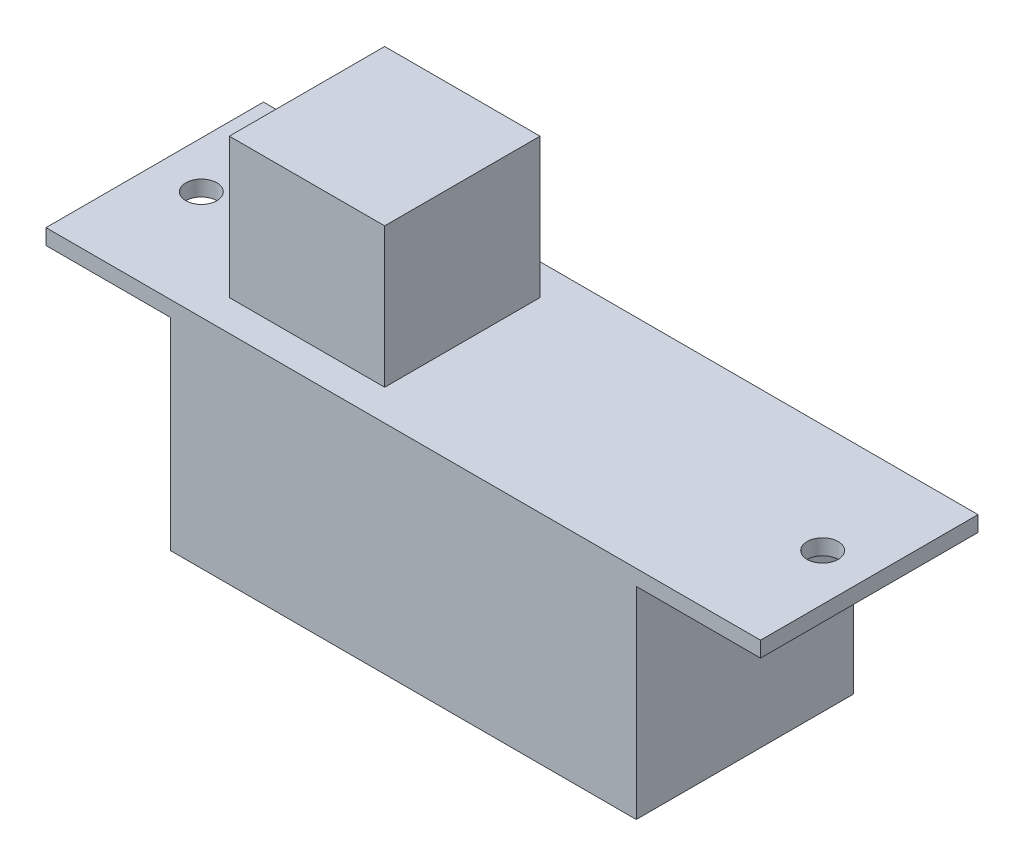
from build123d import *

# Parameters (mm, degrees)
SKETCH1_W           = 15
SKETCH1_H           = 7
BOSS_EXTRUDE1_DEPTH = 7
SKETCH2_W           = 23
SKETCH2_H           = 7
SKETCH2_R           = 0.5
BOSS_EXTRUDE2_DEPTH = 0.5
SKETCH3_W           = 5
SKETCH3_H           = 5
BOSS_EXTRUDE3_DEPTH = 4.5


with BuildPart() as part:
    # Sketch1 → Boss-Extrude1 (new body)
    with BuildSketch(Plane(origin=(0, 0, 0), x_dir=(1, 0, 0), z_dir=(0, 1, 0))):
        Rectangle(SKETCH1_W, SKETCH1_H)
    extrude(amount=BOSS_EXTRUDE1_DEPTH)

    # Sketch2 → Boss-Extrude2 (add)
    with BuildSketch(Plane(origin=(0, 7, 0), x_dir=(1, 0, 0), z_dir=(0, 1, 0))):
        Rectangle(SKETCH2_W, SKETCH2_H)
        with Locations((-10, 0)):
            Circle(SKETCH2_R, mode=Mode.SUBTRACT)
        with Locations((10, 0)):
            Circle(SKETCH2_R, mode=Mode.SUBTRACT)
    extrude(amount=-BOSS_EXTRUDE2_DEPTH)

    # Sketch3 → Boss-Extrude3 (add)
    with BuildSketch(Plane(origin=(0, 7, 0), x_dir=(1, 0, 0), z_dir=(0, 1, 0))):
        with Locations((-4.098942524, 0)):
            Rectangle(SKETCH3_W, SKETCH3_H)
    extrude(amount=BOSS_EXTRUDE3_DEPTH)


solid = part.part
